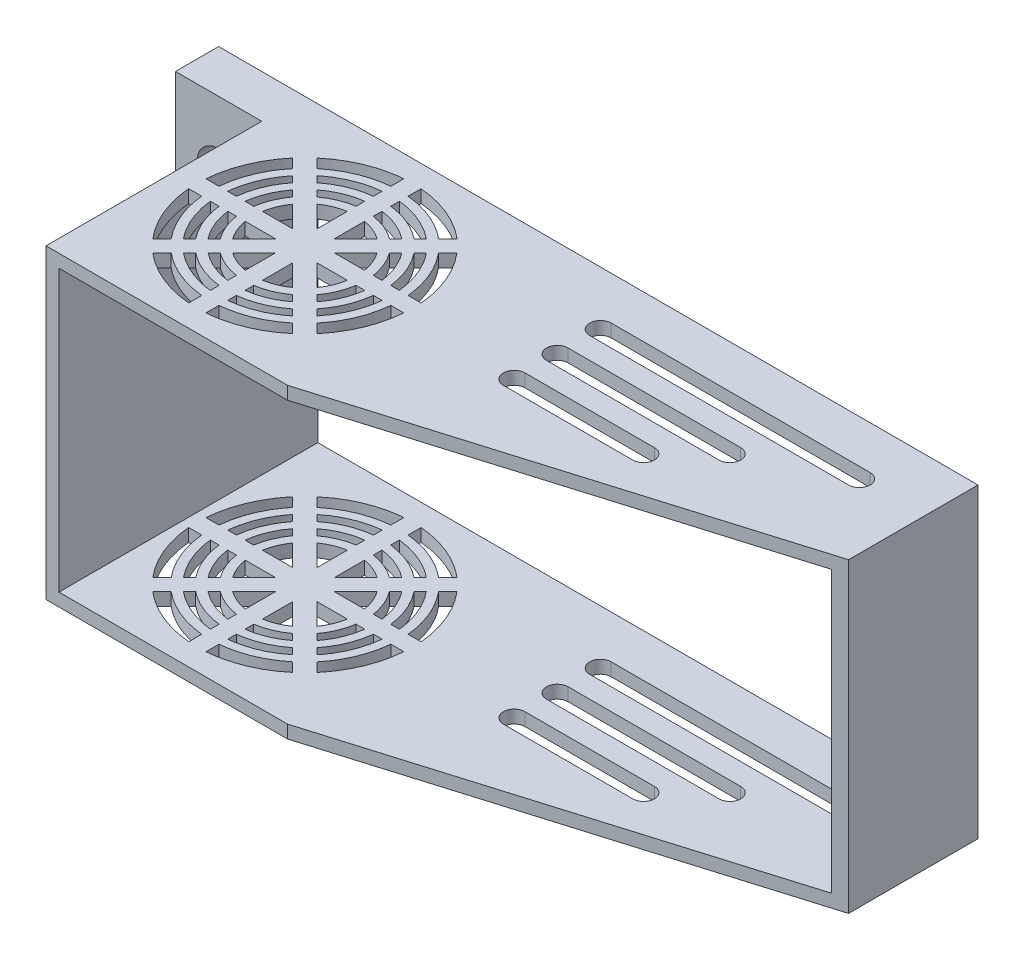
from build123d import *

# Parameters (mm, degrees)
SKETCH1_W           = 156
SKETCH1_H           = 71
BOSS_EXTRUDE1_DEPTH = 60
SKETCH2_W           = 150
SKETCH2_H           = 65
CUT_EXTRUDE1_DEPTH  = 60
CUT_EXTRUDE2_DEPTH  = 3
CUT_EXTRUDE3_REACH  = 183.596
VENT1_START         = -71
VENT1_DEPTH         = 3
SKETCH8_W           = 10
SKETCH8_H           = 71
BOSS_EXTRUDE2_DEPTH = 20
SKETCH9_R           = 5
CUT_EXTRUDE4_DEPTH  = 5
SKETCH10_R          = 2
CUT_EXTRUDE5_DEPTH  = 10


# Read off the part's stored shape, not the designer's step: Vent1
with BuildPart() as part:
    # Sketch1 → Boss-Extrude1 (new body)
    with BuildSketch(Plane.XY):
        with Locations((78, -35.5)):
            Rectangle(SKETCH1_W, SKETCH1_H)
    extrude(amount=BOSS_EXTRUDE1_DEPTH)

    # Sketch2 → Cut-Extrude1 (cut)
    with BuildSketch(Plane(origin=(0, 0, 0), x_dir=(-1, 0, 0), z_dir=(0, 0, -1))):
        with Locations((-78, -35.5)):
            Rectangle(SKETCH2_W, SKETCH2_H)
    extrude(amount=-CUT_EXTRUDE1_DEPTH, mode=Mode.SUBTRACT)

    # Sketch3 → Cut-Extrude2 (cut)
    with BuildSketch(Plane.XZ.offset(71)):
        with BuildLine():
            Line((81, 15), (141, 15))
            ThreePointArc((141, 15), (143.5, 12.5), (141, 10))
            Line((141, 10), (81, 10))
            ThreePointArc((81, 10), (78.5, 12.5), (81, 15))
        make_face()
        with BuildLine():
            Line((81, 25), (121, 25))
            ThreePointArc((121, 25), (123.5, 22.5), (121, 20))
            Line((121, 20), (81, 20))
            ThreePointArc((81, 20), (78.5, 22.5), (81, 25))
        make_face()
        with BuildLine():
            Line((81, 35), (111, 35))
            ThreePointArc((111, 35), (113.5, 32.5), (111, 30))
            Line((111, 30), (81, 30))
            ThreePointArc((81, 30), (78.5, 32.5), (81, 35))
        make_face()
    cut_extrude2 = extrude(amount=-CUT_EXTRUDE2_DEPTH, mode=Mode.SUBTRACT)

    # Cut-Extrude3: up to this face of the body (flat: up to its plane)
    cut_extrude3_end = Plane(part.part.faces().sort_by_distance((78, 0, 30))[0])
    # Sketch4 → Cut-Extrude3 (cut, up to the picked face)
    with BuildSketch(Plane.XZ.offset(71), mode=Mode.PRIVATE) as cut_extrude3_sk1:
        Polygon((156, 60), (156, 30), (56, 60), align=None)
    cut_extrude3_tool1 = split(extrude(cut_extrude3_sk1.sketch, amount=-CUT_EXTRUDE3_REACH, mode=Mode.PRIVATE), bisect_by=cut_extrude3_end, keep=Keep.BOTH, mode=Mode.PRIVATE)
    add(cut_extrude3_tool1.solids().sort_by(Axis((122.666667, -71, 50), (0, 1, 0)))[0], mode=Mode.SUBTRACT)

    # Vent1 outline → Vent1 (cut)
    with BuildSketch(Plane(origin=(0, 0, 0), x_dir=(1, 0, 0), z_dir=(0, 1, 0)).offset(VENT1_START)):
        with BuildLine():
            add(Edge.make_bspline(
                [(13.793251416, -10.964855089), (14.530977176, -10.336782728), (16.612627401, -8.763145865), (20.371242902, -6.754124024), (24.449578192, -5.516974539), (27.034256283, -5.157754843), (28.000021203, -5.080218174)],
                knots=[0.637745943, 0.637745943, 0.637745943, 0.637745943, 0.65625, 0.6875, 0.71875, 0.737254053, 0.737254053, 0.737254053, 0.737254053], degree=3))
            Line((13.793251416, -10.964855089), (15.922328632, -13.093923406))
            add(Edge.make_bspline(
                [(15.922328632, -13.093923406), (16.515826733, -12.599729787), (18.290268248, -11.273534615), (21.526693753, -9.543629141), (25.038420009, -8.478358628), (27.230901175, -8.161400599), (28.000015305, -8.091181726)],
                knots=[0.639488587, 0.639488587, 0.639488587, 0.639488587, 0.65625, 0.6875, 0.71875, 0.735511412, 0.735511412, 0.735511412, 0.735511412], degree=3))
            Line((28.000015305, -8.091181726), (28.000021203, -5.080218174))
        make_face()
        with BuildLine():
            add(Edge.make_bspline(
                [(46.206748584, -49.035144911), (45.469022824, -49.663217272), (43.387372599, -51.236854135), (39.628757098, -53.245875976), (35.550421808, -54.483025461), (32.965743717, -54.842245157), (31.999978797, -54.919781826)],
                knots=[0.137745943, 0.137745943, 0.137745943, 0.137745943, 0.15625, 0.1875, 0.21875, 0.237254053, 0.237254053, 0.237254053, 0.237254053], degree=3))
            Line((46.206748584, -49.035144911), (44.077671368, -46.906076594))
            add(Edge.make_bspline(
                [(44.077671368, -46.906076594), (43.484173267, -47.400270213), (41.709731752, -48.726465385), (38.473306247, -50.456370859), (34.961579991, -51.521641372), (32.769098825, -51.838599401), (31.999984695, -51.908818274)],
                knots=[0.139488587, 0.139488587, 0.139488587, 0.139488587, 0.15625, 0.1875, 0.21875, 0.235511412, 0.235511412, 0.235511412, 0.235511412], degree=3))
            Line((31.999984695, -51.908818274), (31.999978797, -54.919781826))
        make_face()
        with BuildLine():
            add(Edge.make_bspline(
                [(31.999978222, -5.080218128), (32.965743336, -5.15775479), (35.550421623, -5.516974483), (39.628757098, -6.754124024), (43.387372428, -8.763145774), (45.469022517, -10.336782496), (46.206748145, -10.964854716)],
                knots=[0.762745943, 0.762745943, 0.762745943, 0.762745943, 0.78125, 0.8125, 0.84375, 0.862254053, 0.862254053, 0.862254053, 0.862254053], degree=3))
            Line((31.999978222, -5.080218128), (31.999984515, -8.09118171))
            add(Edge.make_bspline(
                [(31.999984515, -8.09118171), (32.769098706, -8.161400582), (34.961579933, -8.478358611), (38.473306247, -9.543629141), (41.709731699, -11.273534587), (43.484173171, -12.599729715), (44.077671229, -13.093923291)],
                knots=[0.764488587, 0.764488587, 0.764488587, 0.764488587, 0.78125, 0.8125, 0.84375, 0.860511412, 0.860511412, 0.860511412, 0.860511412], degree=3))
            Line((44.077671229, -13.093923291), (46.206748145, -10.964854716))
        make_face()
        with BuildLine():
            add(Edge.make_bspline(
                [(28.000021778, -54.919781872), (27.034256664, -54.84224521), (24.449578377, -54.483025517), (20.371242902, -53.245875976), (16.612627572, -51.236854226), (14.530977483, -49.663217504), (13.793251855, -49.035145284)],
                knots=[0.262745943, 0.262745943, 0.262745943, 0.262745943, 0.28125, 0.3125, 0.34375, 0.362254053, 0.362254053, 0.362254053, 0.362254053], degree=3))
            Line((28.000021778, -54.919781872), (28.000015485, -51.90881829))
            add(Edge.make_bspline(
                [(28.000015485, -51.90881829), (27.230901294, -51.838599418), (25.038420067, -51.521641389), (21.526693753, -50.456370859), (18.290268301, -48.726465413), (16.515826829, -47.400270285), (15.922328771, -46.906076709)],
                knots=[0.264488587, 0.264488587, 0.264488587, 0.264488587, 0.28125, 0.3125, 0.34375, 0.360511412, 0.360511412, 0.360511412, 0.360511412], degree=3))
            Line((15.922328771, -46.906076709), (13.793251855, -49.035145284))
        make_face()
        with BuildLine():
            add(Edge.make_bspline(
                [(5.080218128, -28.000021778), (5.15775479, -27.034256664), (5.516974483, -24.449578377), (6.754124024, -20.371242902), (8.763145774, -16.612627572), (10.336782496, -14.530977483), (10.964854716, -13.793251855)],
                knots=[0.512745943, 0.512745943, 0.512745943, 0.512745943, 0.53125, 0.5625, 0.59375, 0.612254053, 0.612254053, 0.612254053, 0.612254053], degree=3))
            Line((5.080218128, -28.000021778), (8.09118171, -28.000015485))
            add(Edge.make_bspline(
                [(8.09118171, -28.000015485), (8.161400582, -27.230901294), (8.478358611, -25.038420067), (9.543629141, -21.526693753), (11.273534587, -18.290268301), (12.599729715, -16.515826829), (13.093923291, -15.922328771)],
                knots=[0.514488587, 0.514488587, 0.514488587, 0.514488587, 0.53125, 0.5625, 0.59375, 0.610511412, 0.610511412, 0.610511412, 0.610511412], degree=3))
            Line((13.093923291, -15.922328771), (10.964854716, -13.793251855))
        make_face()
        with BuildLine():
            add(Edge.make_bspline(
                [(54.919781798, -31.999979144), (54.842245125, -32.965743947), (54.483025427, -35.55042192), (53.245875976, -39.628757098), (51.236854226, -43.387372428), (49.663217504, -45.469022517), (49.035145284, -46.206748145)],
                knots=[0.012745949, 0.012745949, 0.012745949, 0.012745949, 0.03125, 0.0625, 0.09375, 0.112254053, 0.112254053, 0.112254053, 0.112254053], degree=3))
            Line((54.919781798, -31.999979144), (51.90881823, -31.999985175))
            add(Edge.make_bspline(
                [(51.90881823, -31.999985175), (51.838599355, -32.769099144), (51.521641325, -34.961580146), (50.456370859, -38.473306247), (48.726465413, -41.709731699), (47.400270285, -43.484173171), (46.906076709, -44.077671229)],
                knots=[0.014488592, 0.014488592, 0.014488592, 0.014488592, 0.03125, 0.0625, 0.09375, 0.110511412, 0.110511412, 0.110511412, 0.110511412], degree=3))
            Line((46.906076709, -44.077671229), (49.035145284, -46.206748145))
        make_face()
        with BuildLine():
            add(Edge.make_bspline(
                [(49.035144911, -13.793251416), (49.663217272, -14.530977176), (51.236854135, -16.612627401), (53.245875976, -20.371242902), (54.483025551, -24.449578489), (54.842245242, -27.034256895), (54.9197819, -28.000022125)],
                knots=[0.887745943, 0.887745943, 0.887745943, 0.887745943, 0.90625, 0.9375, 0.96875, 0.987254059, 0.987254059, 0.987254059, 0.987254059], degree=3))
            Line((49.035144911, -13.793251416), (46.906076594, -15.922328632))
            add(Edge.make_bspline(
                [(46.906076594, -15.922328632), (47.400270213, -16.515826733), (48.726465385, -18.290268248), (50.456370859, -21.526693753), (51.521641436, -25.038420221), (51.838599464, -27.230901613), (51.908818334, -28.000015966)],
                knots=[0.889488587, 0.889488587, 0.889488587, 0.889488587, 0.90625, 0.9375, 0.96875, 0.985511417, 0.985511417, 0.985511417, 0.985511417], degree=3))
            Line((51.908818334, -28.000015966), (54.9197819, -28.000022125))
        make_face()
        with BuildLine():
            add(Edge.make_bspline(
                [(10.964855089, -46.206748584), (10.336782728, -45.469022824), (8.763145865, -43.387372599), (6.754124024, -39.628757098), (5.516974539, -35.550421808), (5.157754843, -32.965743717), (5.080218174, -31.999978797)],
                knots=[0.387745943, 0.387745943, 0.387745943, 0.387745943, 0.40625, 0.4375, 0.46875, 0.487254053, 0.487254053, 0.487254053, 0.487254053], degree=3))
            Line((10.964855089, -46.206748584), (13.093923406, -44.077671368))
            add(Edge.make_bspline(
                [(13.093923406, -44.077671368), (12.599729787, -43.484173267), (11.273534615, -41.709731752), (9.543629141, -38.473306247), (8.478358628, -34.961579991), (8.161400599, -32.769098825), (8.091181726, -31.999984695)],
                knots=[0.389488587, 0.389488587, 0.389488587, 0.389488587, 0.40625, 0.4375, 0.46875, 0.485511412, 0.485511412, 0.485511412, 0.485511412], degree=3))
            Line((8.091181726, -31.999984695), (5.080218174, -31.999978797))
        make_face()
        with BuildLine():
            add(Edge.make_bspline(
                [(32, -18.167852406), (32.113989501, -18.187113559), (33.000222051, -18.350078205), (34.621803407, -18.841979532), (36.116261344, -19.640783941), (36.858155796, -20.15221158), (36.952378237, -20.219194638)],
                knots=[0.776650184, 0.776650184, 0.776650184, 0.776650184, 0.78125, 0.8125, 0.84375, 0.848349816, 0.848349816, 0.848349816, 0.848349816], degree=3))
            Line((32, -18.167852406), (32, -25.171572875))
            Line((32, -25.171572875), (36.952378237, -20.219194638))
        make_face()
        with BuildLine():
            Line((31.999987192, -14.125544258), (31.999991074, -16.143626579))
            add(Edge.make_bspline(
                [(31.999991074, -16.143626579), (32.244800933, -16.178947323), (33.392110803, -16.375618157), (35.392103975, -16.982309454), (37.235308659, -17.967522883), (38.185646882, -18.639726514), (38.383729496, -18.787857992)],
                knots=[0.77281439, 0.77281439, 0.77281439, 0.77281439, 0.78125, 0.8125, 0.84375, 0.852185626, 0.852185626, 0.852185626, 0.852185626], degree=3))
            Line((38.383729496, -18.787857992), (39.810731482, -17.360860723))
            add(Edge.make_bspline(
                [(31.999987192, -14.125544258), (32.375804297, -14.172877069), (33.784286655, -14.401245201), (36.162404543, -15.122639376), (38.354090797, -16.294120085), (39.511519091, -17.128587058), (39.810731482, -17.360860723)],
                knots=[0.769946454, 0.769946454, 0.769946454, 0.769946454, 0.78125, 0.8125, 0.84375, 0.855053554, 0.855053554, 0.855053554, 0.855053554], degree=3))
        make_face()
        with BuildLine():
            add(Edge.make_bspline(
                [(23.047621763, -20.219194638), (23.141844204, -20.15221158), (23.883738656, -19.640783941), (25.378196593, -18.841979532), (26.999777949, -18.350078205), (27.886010499, -18.187113559), (28, -18.167852406)],
                knots=[0.651650184, 0.651650184, 0.651650184, 0.651650184, 0.65625, 0.6875, 0.71875, 0.723349816, 0.723349816, 0.723349816, 0.723349816], degree=3))
            Line((23.047621763, -20.219194638), (28, -25.171572875))
            Line((28, -25.171572875), (28, -18.167852406))
        make_face()
        with BuildLine():
            Line((20.189269203, -17.360860191), (21.616271642, -18.787857141))
            add(Edge.make_bspline(
                [(21.616271642, -18.787857141), (21.814353891, -18.639725967), (22.764691761, -17.967522659), (24.607896025, -16.982309454), (26.607889653, -16.375618019), (27.755200001, -16.178947163), (28.000010332, -16.143626376)],
                knots=[0.64781439, 0.64781439, 0.64781439, 0.64781439, 0.65625, 0.6875, 0.71875, 0.727185626, 0.727185626, 0.727185626, 0.727185626], degree=3))
            Line((28.000010332, -16.143626376), (28.000013668, -14.12554415))
            add(Edge.make_bspline(
                [(20.189269203, -17.360860191), (20.488481378, -17.128586719), (21.64590946, -16.294119948), (23.837595457, -15.122639376), (26.215713623, -14.401245117), (27.624196274, -14.172876976), (28.000013668, -14.12554415)],
                knots=[0.644946454, 0.644946454, 0.644946454, 0.644946454, 0.65625, 0.6875, 0.71875, 0.730053554, 0.730053554, 0.730053554, 0.730053554], degree=3))
        make_face()
        with BuildLine():
            add(Edge.make_bspline(
                [(36.952378237, -39.780805362), (36.858155796, -39.84778842), (36.116261344, -40.359216059), (34.621803407, -41.158020468), (33.000222051, -41.649921795), (32.113989501, -41.812886441), (32, -41.832147594)],
                knots=[0.151650184, 0.151650184, 0.151650184, 0.151650184, 0.15625, 0.1875, 0.21875, 0.223349816, 0.223349816, 0.223349816, 0.223349816], degree=3))
            Line((36.952378237, -39.780805362), (32, -34.828427125))
            Line((32, -34.828427125), (32, -41.832147594))
        make_face()
        with BuildLine():
            Line((39.810730789, -42.639139815), (38.383728358, -41.212142859))
            add(Edge.make_bspline(
                [(38.383728358, -41.212142859), (38.185646109, -41.360274033), (37.235308239, -42.032477341), (35.392103975, -43.017690546), (33.392110347, -43.624381981), (32.244799998, -43.821052837), (31.999989667, -43.856373624)],
                knots=[0.14781439, 0.14781439, 0.14781439, 0.14781439, 0.15625, 0.1875, 0.21875, 0.227185626, 0.227185626, 0.227185626, 0.227185626], degree=3))
            Line((31.999989667, -43.856373624), (31.999986322, -45.874455852))
            add(Edge.make_bspline(
                [(39.810730789, -42.639139815), (39.511518617, -42.871413285), (38.354090537, -43.705880054), (36.162404543, -44.877360624), (33.784286374, -45.598754884), (32.37580372, -45.827123025), (31.999986322, -45.874455852)],
                knots=[0.144946454, 0.144946454, 0.144946454, 0.144946454, 0.15625, 0.1875, 0.21875, 0.230053555, 0.230053555, 0.230053555, 0.230053555], degree=3))
        make_face()
        with BuildLine():
            add(Edge.make_bspline(
                [(28, -41.832147594), (27.886010499, -41.812886441), (26.999777949, -41.649921795), (25.378196593, -41.158020468), (23.883738656, -40.359216059), (23.141844204, -39.84778842), (23.047621763, -39.780805362)],
                knots=[0.276650184, 0.276650184, 0.276650184, 0.276650184, 0.28125, 0.3125, 0.34375, 0.348349816, 0.348349816, 0.348349816, 0.348349816], degree=3))
            Line((28, -41.832147594), (28, -34.828427125))
            Line((28, -34.828427125), (23.047621763, -39.780805362))
        make_face()
        with BuildLine():
            Line((28.000012798, -45.874455741), (28.000008926, -43.856373421))
            add(Edge.make_bspline(
                [(28.000008926, -43.856373421), (27.755199067, -43.821052677), (26.607889197, -43.624381843), (24.607896025, -43.017690546), (22.764691341, -42.032477117), (21.814353117, -41.360273485), (21.616270504, -41.212142008)],
                knots=[0.27281439, 0.27281439, 0.27281439, 0.27281439, 0.28125, 0.3125, 0.34375, 0.352185626, 0.352185626, 0.352185626, 0.352185626], degree=3))
            Line((21.616270504, -41.212142008), (20.18926851, -42.639139271))
            add(Edge.make_bspline(
                [(28.000012798, -45.874455741), (27.624195696, -45.82712293), (26.215713341, -45.598754798), (23.837595457, -44.877360624), (21.6459092, -43.705879914), (20.488480903, -42.871412939), (20.18926851, -42.639139271)],
                knots=[0.269946454, 0.269946454, 0.269946454, 0.269946454, 0.28125, 0.3125, 0.34375, 0.355053555, 0.355053555, 0.355053555, 0.355053555], degree=3))
        make_face()
        with BuildLine():
            add(Edge.make_bspline(
                [(20.219194638, -36.952378237), (20.15221158, -36.858155796), (19.640783941, -36.116261344), (18.841979532, -34.621803407), (18.350078205, -33.000222051), (18.187113559, -32.113989501), (18.167852406, -32)],
                knots=[0.401650184, 0.401650184, 0.401650184, 0.401650184, 0.40625, 0.4375, 0.46875, 0.473349816, 0.473349816, 0.473349816, 0.473349816], degree=3))
            Line((20.219194638, -36.952378237), (25.171572875, -32))
            Line((25.171572875, -32), (18.167852406, -32))
        make_face()
        with BuildLine():
            Line((17.360860185, -39.810730789), (18.787857141, -38.383728358))
            add(Edge.make_bspline(
                [(18.787857141, -38.383728358), (18.639725967, -38.185646109), (17.967522659, -37.235308239), (16.982309454, -35.392103975), (16.375618019, -33.392110347), (16.178947163, -32.244799999), (16.143626376, -31.999989668)],
                knots=[0.39781439, 0.39781439, 0.39781439, 0.39781439, 0.40625, 0.4375, 0.46875, 0.477185626, 0.477185626, 0.477185626, 0.477185626], degree=3))
            Line((16.143626376, -31.999989668), (14.12554415, -31.999986332))
            add(Edge.make_bspline(
                [(17.360860185, -39.810730789), (17.128586715, -39.511518617), (16.294119946, -38.354090537), (15.122639376, -36.162404543), (14.401245117, -33.784286377), (14.172876976, -32.375803726), (14.12554415, -31.999986332)],
                knots=[0.394946454, 0.394946454, 0.394946454, 0.394946454, 0.40625, 0.4375, 0.46875, 0.480053554, 0.480053554, 0.480053554, 0.480053554], degree=3))
        make_face()
        with BuildLine():
            add(Edge.make_bspline(
                [(39.780805362, -23.047621763), (39.84778842, -23.141844204), (40.359216059, -23.883738656), (41.158020468, -25.378196593), (41.649921795, -26.999777949), (41.812886441, -27.886010499), (41.832147594, -28)],
                knots=[0.901650184, 0.901650184, 0.901650184, 0.901650184, 0.90625, 0.9375, 0.96875, 0.973349816, 0.973349816, 0.973349816, 0.973349816], degree=3))
            Line((39.780805362, -23.047621763), (34.828427125, -28))
            Line((34.828427125, -28), (41.832147594, -28))
        make_face()
        with BuildLine():
            Line((42.639139809, -20.189269203), (41.212142859, -21.616271642))
            add(Edge.make_bspline(
                [(41.212142859, -21.616271642), (41.360274033, -21.814353891), (42.032477341, -22.764691761), (43.017690546, -24.607896025), (43.624382021, -26.607889786), (43.821052883, -27.755200274), (43.856373683, -28.000010743)],
                knots=[0.89781439, 0.89781439, 0.89781439, 0.89781439, 0.90625, 0.9375, 0.96875, 0.977185631, 0.977185631, 0.977185631, 0.977185631], degree=3))
            Line((43.856373683, -28.000010743), (45.874455921, -28.000014232))
            add(Edge.make_bspline(
                [(42.639139809, -20.189269203), (42.871413281, -20.488481378), (43.705880052, -21.64590946), (44.877360624, -23.837595457), (45.598754938, -26.215713805), (45.827123085, -27.624196648), (45.874455921, -28.000014232)],
                knots=[0.894946454, 0.894946454, 0.894946454, 0.894946454, 0.90625, 0.9375, 0.96875, 0.98005356, 0.98005356, 0.98005356, 0.98005356], degree=3))
        make_face()
        with BuildLine():
            add(Edge.make_bspline(
                [(18.167852406, -28), (18.187113559, -27.886010499), (18.350078205, -26.999777949), (18.841979532, -25.378196593), (19.640783941, -23.883738656), (20.15221158, -23.141844204), (20.219194638, -23.047621763)],
                knots=[0.526650184, 0.526650184, 0.526650184, 0.526650184, 0.53125, 0.5625, 0.59375, 0.598349816, 0.598349816, 0.598349816, 0.598349816], degree=3))
            Line((18.167852406, -28), (25.171572875, -28))
            Line((25.171572875, -28), (20.219194638, -23.047621763))
        make_face()
        with BuildLine():
            Line((14.125544259, -28.000012798), (16.143626579, -28.000008926))
            add(Edge.make_bspline(
                [(16.143626579, -28.000008926), (16.178947323, -27.755199067), (16.375618157, -26.607889197), (16.982309454, -24.607896025), (17.967522883, -22.764691341), (18.639726514, -21.814353118), (18.787857992, -21.616270504)],
                knots=[0.52281439, 0.52281439, 0.52281439, 0.52281439, 0.53125, 0.5625, 0.59375, 0.602185626, 0.602185626, 0.602185626, 0.602185626], degree=3))
            Line((18.787857992, -21.616270504), (17.360860723, -20.189268518))
            add(Edge.make_bspline(
                [(14.125544259, -28.000012798), (14.17287707, -27.624195696), (14.401245202, -26.215713341), (15.122639376, -23.837595457), (16.294120085, -21.645909203), (17.128587058, -20.488480909), (17.360860723, -20.189268518)],
                knots=[0.519946454, 0.519946454, 0.519946454, 0.519946454, 0.53125, 0.5625, 0.59375, 0.605053554, 0.605053554, 0.605053554, 0.605053554], degree=3))
        make_face()
        with BuildLine():
            Line((45.87445567, -31.999987766), (43.856373362, -31.999991485))
            add(Edge.make_bspline(
                [(43.856373362, -31.999991485), (43.82105263, -32.244801206), (43.624381802, -33.392110936), (43.017690546, -35.392103975), (42.032477117, -37.235308659), (41.360273485, -38.185646883), (41.212142008, -38.383729496)],
                knots=[0.022814395, 0.022814395, 0.022814395, 0.022814395, 0.03125, 0.0625, 0.09375, 0.102185626, 0.102185626, 0.102185626, 0.102185626], degree=3))
            Line((41.212142008, -38.383729496), (42.639139271, -39.81073149))
            add(Edge.make_bspline(
                [(45.87445567, -31.999987766), (45.82712287, -32.375804678), (45.598754743, -33.78428684), (44.877360624, -36.162404543), (43.705879914, -38.3540908), (42.871412939, -39.511519097), (42.639139271, -39.81073149)],
                knots=[0.01994646, 0.01994646, 0.01994646, 0.01994646, 0.03125, 0.0625, 0.09375, 0.105053555, 0.105053555, 0.105053555, 0.105053555], degree=3))
        make_face()
        with BuildLine():
            add(Edge.make_bspline(
                [(41.832147594, -32), (41.812886441, -32.113989501), (41.649921795, -33.000222051), (41.158020468, -34.621803407), (40.359216059, -36.116261344), (39.84778842, -36.858155796), (39.780805362, -36.952378237)],
                knots=[0.026650184, 0.026650184, 0.026650184, 0.026650184, 0.03125, 0.0625, 0.09375, 0.098349816, 0.098349816, 0.098349816, 0.098349816], degree=3))
            Line((41.832147594, -32), (34.828427125, -32))
            Line((34.828427125, -32), (39.780805362, -36.952378237))
        make_face()
        with BuildLine():
            Line((31.999984483, -10.10032819), (31.99998522, -12.111522785))
            add(Edge.make_bspline(
                [(31.99998522, -12.111522785), (32.50688381, -12.168184784), (34.176627664, -12.426922344), (36.932705111, -13.262969298), (39.472720753, -14.620635944), (40.836363138, -15.618368158), (41.23486075, -15.936733598)],
                knots=[0.767720394, 0.767720394, 0.767720394, 0.767720394, 0.78125, 0.8125, 0.84375, 0.85727961, 0.85727961, 0.85727961, 0.85727961], degree=3))
            Line((41.23486075, -15.936733598), (42.656990333, -14.514604564))
            add(Edge.make_bspline(
                [(31.999984483, -10.10032819), (32.637989519, -10.164447774), (34.569070628, -10.452630415), (37.703005679, -11.403299219), (40.591256779, -12.947101596), (42.160513239, -14.108806256), (42.656990333, -14.514604564)],
                knots=[0.765942076, 0.765942076, 0.765942076, 0.765942076, 0.78125, 0.8125, 0.84375, 0.859057924, 0.859057924, 0.859057924, 0.859057924], degree=3))
        make_face()
        with BuildLine():
            Line((17.34300971, -14.514604529), (18.765139567, -15.936733345))
            add(Edge.make_bspline(
                [(18.765139567, -15.936733345), (19.163637081, -15.618367998), (20.527279367, -14.62063588), (23.067294889, -13.262969298), (25.823372466, -12.426922305), (27.493116458, -12.168184742), (28.000015184, -12.11152274)],
                knots=[0.642720394, 0.642720394, 0.642720394, 0.642720394, 0.65625, 0.6875, 0.71875, 0.73227961, 0.73227961, 0.73227961, 0.73227961], degree=3))
            Line((28.000015184, -12.11152274), (28.000015571, -10.100328184))
            add(Edge.make_bspline(
                [(17.34300971, -14.514604529), (17.83948679, -14.108806235), (19.408743237, -12.947101588), (22.296994321, -11.403299219), (25.43092939, -10.45263041), (27.362010517, -10.164447769), (28.000015571, -10.100328184)],
                knots=[0.640942076, 0.640942076, 0.640942076, 0.640942076, 0.65625, 0.6875, 0.71875, 0.734057924, 0.734057924, 0.734057924, 0.734057924], degree=3))
        make_face()
        with BuildLine():
            Line((42.656990285, -45.485395475), (41.234860432, -44.063266655))
            add(Edge.make_bspline(
                [(41.234860432, -44.063266655), (40.836362919, -44.381632002), (39.472720633, -45.37936412), (36.932705111, -46.737030702), (34.176627534, -47.573077695), (32.506883542, -47.831815258), (31.999984816, -47.88847726)],
                knots=[0.142720394, 0.142720394, 0.142720394, 0.142720394, 0.15625, 0.1875, 0.21875, 0.23227961, 0.23227961, 0.23227961, 0.23227961], degree=3))
            Line((31.999984816, -47.88847726), (31.999984428, -49.899671816))
            add(Edge.make_bspline(
                [(42.656990285, -45.485395475), (42.160513206, -45.891193768), (40.591256761, -47.052898413), (37.703005679, -48.596700781), (34.56907061, -49.54736959), (32.637989482, -49.835552232), (31.999984428, -49.899671816)],
                knots=[0.140942076, 0.140942076, 0.140942076, 0.140942076, 0.15625, 0.1875, 0.21875, 0.234057924, 0.234057924, 0.234057924, 0.234057924], degree=3))
        make_face()
        with BuildLine():
            Line((28.00001551, -49.89967181), (28.00001478, -47.888477215))
            add(Edge.make_bspline(
                [(28.00001478, -47.888477215), (27.49311619, -47.831815216), (25.823372336, -47.573077656), (23.067294889, -46.737030702), (20.527279247, -45.379364056), (19.163636862, -44.381631842), (18.76513925, -44.063266402)],
                knots=[0.267720394, 0.267720394, 0.267720394, 0.267720394, 0.28125, 0.3125, 0.34375, 0.35727961, 0.35727961, 0.35727961, 0.35727961], degree=3))
            Line((18.76513925, -44.063266402), (17.343009667, -45.485395436))
            add(Edge.make_bspline(
                [(28.00001551, -49.89967181), (27.362010476, -49.835552225), (25.43092937, -49.547369584), (22.296994321, -48.596700781), (19.40874322, -47.052898404), (17.83948676, -45.891193743), (17.343009667, -45.485395436)],
                knots=[0.265942076, 0.265942076, 0.265942076, 0.265942076, 0.28125, 0.3125, 0.34375, 0.359057924, 0.359057924, 0.359057924, 0.359057924], degree=3))
        make_face()
        with BuildLine():
            Line((14.514604525, -42.656990285), (15.936733345, -41.234860432))
            add(Edge.make_bspline(
                [(15.936733345, -41.234860432), (15.618367998, -40.836362919), (14.62063588, -39.472720633), (13.262969298, -36.932705111), (12.426922305, -34.176627534), (12.168184742, -32.506883542), (12.11152274, -31.999984816)],
                knots=[0.392720394, 0.392720394, 0.392720394, 0.392720394, 0.40625, 0.4375, 0.46875, 0.48227961, 0.48227961, 0.48227961, 0.48227961], degree=3))
            Line((12.11152274, -31.999984816), (10.100328184, -31.999984429))
            add(Edge.make_bspline(
                [(14.514604525, -42.656990285), (14.108806232, -42.160513206), (12.947101587, -40.591256761), (11.403299219, -37.703005679), (10.45263041, -34.56907061), (10.164447769, -32.637989483), (10.100328184, -31.999984429)],
                knots=[0.390942076, 0.390942076, 0.390942076, 0.390942076, 0.40625, 0.4375, 0.46875, 0.484057924, 0.484057924, 0.484057924, 0.484057924], degree=3))
        make_face()
        with BuildLine():
            Line((45.485395471, -17.34300971), (44.063266655, -18.765139567))
            add(Edge.make_bspline(
                [(44.063266655, -18.765139567), (44.381632002, -19.163637081), (45.37936412, -20.527279367), (46.737030702, -23.067294889), (47.573077758, -25.823372673), (47.831815324, -27.493116883), (47.888477332, -28.000015824)],
                knots=[0.892720394, 0.892720394, 0.892720394, 0.892720394, 0.90625, 0.9375, 0.96875, 0.982279616, 0.982279616, 0.982279616, 0.982279616], degree=3))
            Line((47.888477332, -28.000015824), (49.899671883, -28.000016235))
            add(Edge.make_bspline(
                [(45.485395471, -17.34300971), (45.891193765, -17.83948679), (47.052898412, -19.408743237), (48.596700781, -22.296994321), (49.547369655, -25.430929604), (49.835552297, -27.362010957), (49.899671883, -28.000016235)],
                knots=[0.890942076, 0.890942076, 0.890942076, 0.890942076, 0.90625, 0.9375, 0.96875, 0.984057929, 0.984057929, 0.984057929, 0.984057929], degree=3))
        make_face()
        with BuildLine():
            Line((10.10032819, -28.00001551), (12.111522785, -28.00001478))
            add(Edge.make_bspline(
                [(12.111522785, -28.00001478), (12.168184784, -27.49311619), (12.426922344, -25.823372336), (13.262969298, -23.067294889), (14.620635944, -20.527279247), (15.618368158, -19.163636862), (15.936733598, -18.76513925)],
                knots=[0.517720394, 0.517720394, 0.517720394, 0.517720394, 0.53125, 0.5625, 0.59375, 0.60727961, 0.60727961, 0.60727961, 0.60727961], degree=3))
            Line((15.936733598, -18.76513925), (14.514604564, -17.343009667))
            add(Edge.make_bspline(
                [(10.10032819, -28.00001551), (10.164447775, -27.362010476), (10.452630416, -25.43092937), (11.403299219, -22.296994321), (12.947101596, -19.408743221), (14.108806256, -17.839486761), (14.514604564, -17.343009667)],
                knots=[0.515942076, 0.515942076, 0.515942076, 0.515942076, 0.53125, 0.5625, 0.59375, 0.609057924, 0.609057924, 0.609057924, 0.609057924], degree=3))
        make_face()
        with BuildLine():
            Line((49.899671743, -31.999985153), (47.888477144, -31.99998586))
            add(Edge.make_bspline(
                [(47.888477144, -31.99998586), (47.83181515, -32.506884234), (47.573077593, -34.17662787), (46.737030702, -36.932705111), (45.379364056, -39.472720753), (44.381631842, -40.836363138), (44.063266402, -41.23486075)],
                knots=[0.017720399, 0.017720399, 0.017720399, 0.017720399, 0.03125, 0.0625, 0.09375, 0.10727961, 0.10727961, 0.10727961, 0.10727961], degree=3))
            Line((44.063266402, -41.23486075), (45.485395436, -42.656990333))
            add(Edge.make_bspline(
                [(49.899671743, -31.999985153), (49.83555216, -32.637989964), (49.547369519, -34.569070843), (48.596700781, -37.703005679), (47.052898404, -40.59125678), (45.891193743, -42.16051324), (45.485395436, -42.656990333)],
                knots=[0.015942082, 0.015942082, 0.015942082, 0.015942082, 0.03125, 0.0625, 0.09375, 0.109057924, 0.109057924, 0.109057924, 0.109057924], degree=3))
        make_face()
    vent1 = extrude(amount=VENT1_DEPTH, mode=Mode.SUBTRACT)

    # Mirror1: Cut-Extrude2, Vent1 across plane
    add(cut_extrude2.mirror(Plane(origin=(0, -35.5, 0), x_dir=(0, 0, 1), z_dir=(0, -1, 0))), mode=Mode.SUBTRACT)
    add(vent1.mirror(Plane(origin=(0, -35.5, 0), x_dir=(0, 0, 1), z_dir=(0, -1, 0))), mode=Mode.SUBTRACT)

    # Sketch8 → Boss-Extrude2 (add)
    with BuildSketch(Plane.ZY):
        with Locations((5, -35.5)):
            Rectangle(SKETCH8_W, SKETCH8_H)
    extrude(amount=BOSS_EXTRUDE2_DEPTH)

    # Sketch9 → Cut-Extrude4 (cut)
    with BuildSketch(Plane.XY.offset(10)):
        with Locations((-10, -15.5)):
            Circle(SKETCH9_R)
        with Locations((-10, -55.5)):
            Circle(SKETCH9_R)
    extrude(amount=-CUT_EXTRUDE4_DEPTH, mode=Mode.SUBTRACT)

    # Sketch10 → Cut-Extrude5 (cut)
    with BuildSketch(Plane.XY.offset(10)):
        with Locations((-10, -15.5)):
            Circle(SKETCH10_R)
        with Locations((-10, -55.5)):
            Circle(SKETCH10_R)
    extrude(amount=-CUT_EXTRUDE5_DEPTH, mode=Mode.SUBTRACT)


solid = part.part
